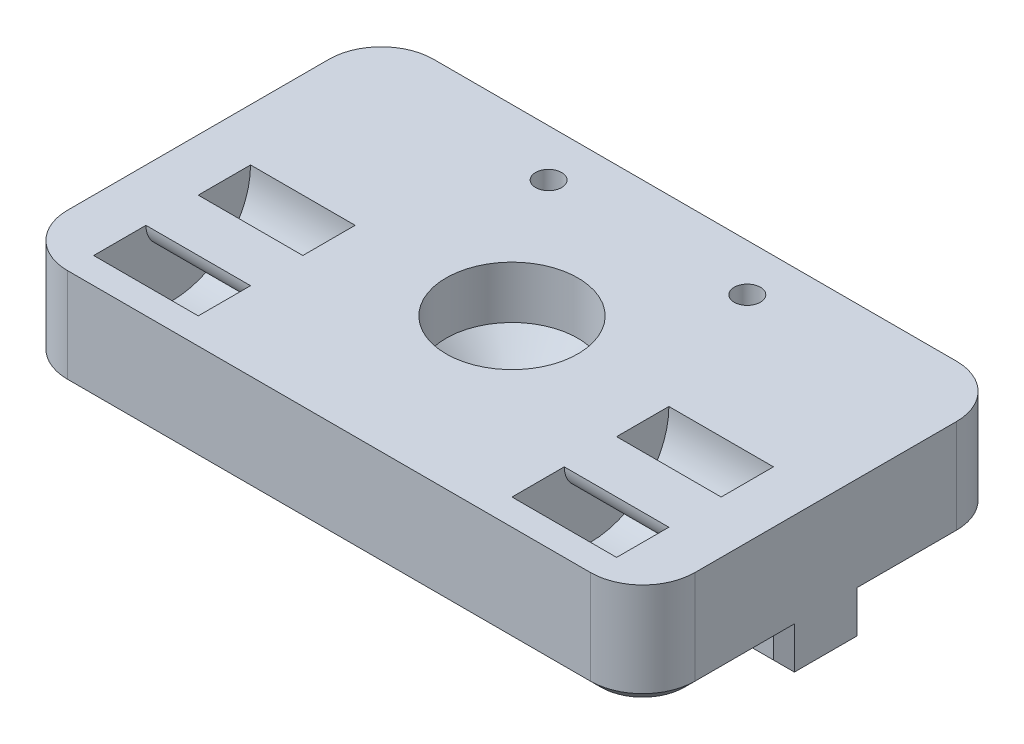
from build123d import *

# Parameters (mm, degrees)
BOSS_EXTRUDE1_DEPTH   = 30
CUT_EXTRUDE1_DEPTH    = 5
FILLET1_R             = 5
CHAMFER1_SIZE         = 1
M3X0_5_TAPPED_HOLE1_D = 2.5


with BuildPart() as part:
    # Sketch1 → Boss-Extrude1 (new, symmetric)
    with BuildSketch(Plane(origin=(0, 0, 0), x_dir=(0, 0, -1), z_dir=(1, 0, 0))):
        Polygon((-17.5, 10), (17.5, 10), (17.5, 0), (4, 0), (4, -3), (-4, -3), (-4, 0), (-17.5, 0), align=None)
    extrude(amount=BOSS_EXTRUDE1_DEPTH, both=True)

    # Sketch3 → CSK for M6 Flat Head Machine Screw1 (revolve, cut)
    with BuildSketch(Plane(origin=(0, 10, 0), x_dir=(0, 0, 1), z_dir=(1, 0, 0))):
        Polygon((0, 0), (0, 13), (3.3, 13), (3.3, 8), (6.3, 5), (6.3, 0), align=None)
    revolve(axis=Axis((0, 16.35, 0), (0, -1, 0)), mode=Mode.SUBTRACT)

    # Sketch4 → Cut-Extrude1 (cut, symmetric)
    with BuildSketch(Plane(origin=(20, 0, 0), x_dir=(0, 0, -1), z_dir=(1, 0, 0))):
        with BuildLine():
            Line((-15, 10), (-10, 10))
            ThreePointArc((-10, 10), (-7.5, 7.5), (-5, 10))
            Line((-5, 10), (0, 10))
            ThreePointArc((0, 10), (-7.5, 2.5), (-15, 10))
        make_face()
    cut_extrude1 = extrude(amount=CUT_EXTRUDE1_DEPTH, both=True, mode=Mode.SUBTRACT)

    # Mirror1: Cut-Extrude1 across plane
    add(cut_extrude1.mirror(Plane(origin=(0, 0, 0), x_dir=(0, 0, 1), z_dir=(1, 0, 0))), mode=Mode.SUBTRACT)

    # Fillet1
    fillet1_edges = [part.edges().sort_by_distance(p)[0] for p in [
        (-30, 5, 17.5),
        (30, 5, -17.5),
        (30, 5, 17.5),
        (-30, 5, -17.5),
    ]]
    fillet(fillet1_edges, radius=FILLET1_R)

    # Chamfer1
    # the kernel refuses this chamfer: 1 mm, written as the material it takes off along each edge
    with BuildSketch(Plane(origin=(-30, -5.571682988, 4), x_dir=(-0.027495876610585623, 0, -0.9996219169112968), z_dir=(0, 1, 0)), Plane(origin=(-30, 0, -4), x_dir=(-0.027495876610585623, 0, 0.9996219169112968), z_dir=(0, -1, 0))) as chamfer1_piece_1:
        Polygon((CHAMFER1_SIZE * 0.999621916911, -CHAMFER1_SIZE * 0.0274958766106), (-CHAMFER1_SIZE * 0.0274958766106, -CHAMFER1_SIZE * 0.999621916911), (0, 0), align=None)
    extrude(amount=5.571682988, mode=Mode.SUBTRACT)
    with BuildSketch(Plane(origin=(30, -5.571682988, 4), x_dir=(0.027495876610585623, 0, -0.9996219169112968), z_dir=(0, 1, 0)), Plane(origin=(30, 0, -4), x_dir=(0.027495876610585623, 0, 0.9996219169112968), z_dir=(0, -1, 0))) as chamfer1_piece_2:
        Polygon((CHAMFER1_SIZE * 0.999621916911, CHAMFER1_SIZE * 0.0274958766106), (-CHAMFER1_SIZE * 0.0274958766106, CHAMFER1_SIZE * 0.999621916911), (0, 0), align=None)
    extrude(amount=5.571682988, mode=Mode.SUBTRACT)
    with BuildSketch(Plane(origin=(32.571682988, -3, -4), x_dir=(0, 0.9996219169112968, -0.027495876610586494), z_dir=(-1, 0, 0))) as chamfer1_piece_3:
        Polygon((CHAMFER1_SIZE * 0.999621916911, -CHAMFER1_SIZE * 0.0274958766106), (-CHAMFER1_SIZE * 0.0274958766106, -CHAMFER1_SIZE * 0.999621916911), (0, 0), align=None)
    extrude(amount=65.143365976, mode=Mode.SUBTRACT)
    with BuildSketch(Plane(origin=(32.571682988, -3, 4), x_dir=(0, 0.9996219169112968, 0.027495876610586494), z_dir=(-1, 0, 0))) as chamfer1_piece_4:
        Polygon((CHAMFER1_SIZE * 0.999621916911, CHAMFER1_SIZE * 0.0274958766106), (-CHAMFER1_SIZE * 0.0274958766106, CHAMFER1_SIZE * 0.999621916911), (0, 0), align=None)
    extrude(amount=65.143365976, mode=Mode.SUBTRACT)
    with BuildSketch(Plane(origin=(30, 0, -12.5), x_dir=(0.027495876610585623, 0.9996219169112968, 0), z_dir=(0, 0, 1)), Plane(origin=(30, 0, 4), x_dir=(0.02749587661058563, 0.9996219169112968, 0), z_dir=(0, 0, 1))) as chamfer1_piece_5:
        Polygon((CHAMFER1_SIZE * 0.999621916911, CHAMFER1_SIZE * 0.0274958766106), (-CHAMFER1_SIZE * 0.0274958766106, CHAMFER1_SIZE * 0.999621916911), (0, 0), align=None)
    extrude(amount=8.5, mode=Mode.SUBTRACT)
    with BuildSketch(Plane(origin=(-30, 0, 4), x_dir=(-0.02749587661058563, 0.9996219169112968, 0), z_dir=(0, 0, 1)), Plane(origin=(-30, 0, -12.5), x_dir=(-0.027495876610585623, 0.9996219169112968, 0), z_dir=(0, 0, 1))) as chamfer1_piece_6:
        Polygon((CHAMFER1_SIZE * 0.999621916911, -CHAMFER1_SIZE * 0.0274958766106), (-CHAMFER1_SIZE * 0.0274958766106, -CHAMFER1_SIZE * 0.999621916911), (0, 0), align=None)
    extrude(amount=8.5, mode=Mode.SUBTRACT)
    with BuildSketch(Plane(origin=(-25, 0, 17.5), x_dir=(0, 0.9996219169112968, 0.02749587661058563), z_dir=(1, 0, 0)), Plane(origin=(25, 0, -17.5), x_dir=(0, 0.9996219169112968, -0.027495876610585623), z_dir=(-1, 0, 0))) as chamfer1_piece_7:
        Polygon((CHAMFER1_SIZE * 0.999621916911, -CHAMFER1_SIZE * 0.0274958766106), (-CHAMFER1_SIZE * 0.0274958766106, -CHAMFER1_SIZE * 0.999621916911), (0, 0), align=None)
    extrude(amount=50, mode=Mode.SUBTRACT)
    with BuildSketch(Plane(origin=(-25, 0, 12.5), x_dir=(0, 0, 1), z_dir=(1, 0, 0))) as chamfer1_piece_8:
        Polygon((5, -CHAMFER1_SIZE), (5 - CHAMFER1_SIZE, 0), (5, 0), align=None)
    revolve(axis=Axis((-25, 0, 12.5), (0, -1, 0)), revolution_arc=90, mode=Mode.SUBTRACT)
    with BuildSketch(Plane(origin=(25, 0, 12.5), x_dir=(0, 0, 1), z_dir=(-1, 0, 0))) as chamfer1_piece_9:
        Polygon((5, CHAMFER1_SIZE), (5 - CHAMFER1_SIZE, 0), (5, 0), align=None)
    revolve(axis=Axis((25, 0, 12.5), (0, 1, 0)), revolution_arc=90, mode=Mode.SUBTRACT)
    with BuildSketch(Plane(origin=(-25, 0, -12.5), x_dir=(-1, 0, 0), z_dir=(0, 0, 1))) as chamfer1_piece_10:
        Polygon((5, -CHAMFER1_SIZE), (5 - CHAMFER1_SIZE, 0), (5, 0), align=None)
    revolve(axis=Axis((-25, 0, -12.5), (0, -1, 0)), revolution_arc=90, mode=Mode.SUBTRACT)
    with BuildSketch(Plane(origin=(25, 0, -12.5), x_dir=(1, 0, 0), z_dir=(0, 0, 1))) as chamfer1_piece_11:
        Polygon((5, CHAMFER1_SIZE), (5 - CHAMFER1_SIZE, 0), (5, 0), align=None)
    revolve(axis=Axis((25, 0, -12.5), (0, 1, 0)), revolution_arc=90, mode=Mode.SUBTRACT)
    with BuildSketch(Plane(origin=(-30, 0, 1.428317012), x_dir=(-0.02749587661058563, 0.9996219169112968, 0), z_dir=(0, 0, 1))) as chamfer1_piece_12a_section:
        Polygon((CHAMFER1_SIZE * 0.999621916911, -CHAMFER1_SIZE * 0.0274958766106), (-CHAMFER1_SIZE * 0.0274958766106, -CHAMFER1_SIZE * 0.999621916911), (0, 0), align=None)
    chamfer1_piece_12a = extrude(amount=11.071682988, mode=Mode.PRIVATE)
    chamfer1_piece_12a = split(chamfer1_piece_12a, bisect_by=Plane(origin=(-29.670206373, 0.329793627, 4), z_dir=(0, 0, -1)), keep=Keep.TOP, mode=Mode.PRIVATE)
    with BuildSketch(Plane(origin=(-30, -5.571682988, 4), x_dir=(-0.027495876610585623, 0, -0.9996219169112968), z_dir=(0, 1, 0))) as chamfer1_piece_12b_section:
        Polygon((CHAMFER1_SIZE * 0.999621916911, -CHAMFER1_SIZE * 0.0274958766106), (-CHAMFER1_SIZE * 0.0274958766106, -CHAMFER1_SIZE * 0.999621916911), (0, 0), align=None)
    chamfer1_piece_12b = extrude(amount=8.143365976, mode=Mode.PRIVATE)
    chamfer1_piece_12b = split(chamfer1_piece_12b, bisect_by=Plane(origin=(-29.670206373, 0, 3.670206373), z_dir=(0, 1, 0)), keep=Keep.TOP, mode=Mode.PRIVATE)
    chamfer1_piece_12 = chamfer1_piece_12a & chamfer1_piece_12b
    add(chamfer1_piece_12, mode=Mode.SUBTRACT)
    with BuildSketch(Plane(origin=(30, 0, 1.428317012), x_dir=(0.02749587661058563, 0.9996219169112968, 0), z_dir=(0, 0, 1))) as chamfer1_piece_13a_section:
        Polygon((CHAMFER1_SIZE * 0.999621916911, CHAMFER1_SIZE * 0.0274958766106), (-CHAMFER1_SIZE * 0.0274958766106, CHAMFER1_SIZE * 0.999621916911), (0, 0), align=None)
    chamfer1_piece_13a = extrude(amount=11.071682988, mode=Mode.PRIVATE)
    chamfer1_piece_13a = split(chamfer1_piece_13a, bisect_by=Plane(origin=(29.670206373, 0.329793627, 4), z_dir=(0, 0, -1)), keep=Keep.TOP, mode=Mode.PRIVATE)
    with BuildSketch(Plane(origin=(30, -5.571682988, 4), x_dir=(0.027495876610585623, 0, -0.9996219169112968), z_dir=(0, 1, 0))) as chamfer1_piece_13b_section:
        Polygon((CHAMFER1_SIZE * 0.999621916911, CHAMFER1_SIZE * 0.0274958766106), (-CHAMFER1_SIZE * 0.0274958766106, CHAMFER1_SIZE * 0.999621916911), (0, 0), align=None)
    chamfer1_piece_13b = extrude(amount=8.143365976, mode=Mode.PRIVATE)
    chamfer1_piece_13b = split(chamfer1_piece_13b, bisect_by=Plane(origin=(29.670206373, 0, 3.670206373), z_dir=(0, 1, 0)), keep=Keep.TOP, mode=Mode.PRIVATE)
    chamfer1_piece_13 = chamfer1_piece_13a & chamfer1_piece_13b
    add(chamfer1_piece_13, mode=Mode.SUBTRACT)
    with BuildSketch(Plane(origin=(30, 0, -12.5), x_dir=(0.027495876610585623, 0.9996219169112968, 0), z_dir=(0, 0, 1))) as chamfer1_piece_14a_section:
        Polygon((CHAMFER1_SIZE * 0.999621916911, CHAMFER1_SIZE * 0.0274958766106), (-CHAMFER1_SIZE * 0.0274958766106, CHAMFER1_SIZE * 0.999621916911), (0, 0), align=None)
    chamfer1_piece_14a = extrude(amount=11.071682988, mode=Mode.PRIVATE)
    chamfer1_piece_14a = split(chamfer1_piece_14a, bisect_by=Plane(origin=(29.670206373, 0.329793627, -4), z_dir=(0, 0, 1)), keep=Keep.TOP, mode=Mode.PRIVATE)
    with BuildSketch(Plane(origin=(30, 2.571682988, -4), x_dir=(0.027495876610585623, 0, 0.9996219169112968), z_dir=(0, -1, 0))) as chamfer1_piece_14b_section:
        Polygon((CHAMFER1_SIZE * 0.999621916911, CHAMFER1_SIZE * 0.0274958766106), (-CHAMFER1_SIZE * 0.0274958766106, CHAMFER1_SIZE * 0.999621916911), (0, 0), align=None)
    chamfer1_piece_14b = extrude(amount=8.143365976, mode=Mode.PRIVATE)
    chamfer1_piece_14b = split(chamfer1_piece_14b, bisect_by=Plane(origin=(29.670206373, 0, -3.670206373), z_dir=(0, 1, 0)), keep=Keep.TOP, mode=Mode.PRIVATE)
    chamfer1_piece_14 = chamfer1_piece_14a & chamfer1_piece_14b
    add(chamfer1_piece_14, mode=Mode.SUBTRACT)
    with BuildSketch(Plane(origin=(-30, 0, -12.5), x_dir=(-0.027495876610585623, 0.9996219169112968, 0), z_dir=(0, 0, 1))) as chamfer1_piece_15a_section:
        Polygon((CHAMFER1_SIZE * 0.999621916911, -CHAMFER1_SIZE * 0.0274958766106), (-CHAMFER1_SIZE * 0.0274958766106, -CHAMFER1_SIZE * 0.999621916911), (0, 0), align=None)
    chamfer1_piece_15a = extrude(amount=11.071682988, mode=Mode.PRIVATE)
    chamfer1_piece_15a = split(chamfer1_piece_15a, bisect_by=Plane(origin=(-29.670206373, 0.329793627, -4), z_dir=(0, 0, 1)), keep=Keep.TOP, mode=Mode.PRIVATE)
    with BuildSketch(Plane(origin=(-30, 2.571682988, -4), x_dir=(-0.027495876610585623, 0, 0.9996219169112968), z_dir=(0, -1, 0))) as chamfer1_piece_15b_section:
        Polygon((CHAMFER1_SIZE * 0.999621916911, -CHAMFER1_SIZE * 0.0274958766106), (-CHAMFER1_SIZE * 0.0274958766106, -CHAMFER1_SIZE * 0.999621916911), (0, 0), align=None)
    chamfer1_piece_15b = extrude(amount=8.143365976, mode=Mode.PRIVATE)
    chamfer1_piece_15b = split(chamfer1_piece_15b, bisect_by=Plane(origin=(-29.670206373, 0, -3.670206373), z_dir=(0, 1, 0)), keep=Keep.TOP, mode=Mode.PRIVATE)
    chamfer1_piece_15 = chamfer1_piece_15a & chamfer1_piece_15b
    add(chamfer1_piece_15, mode=Mode.SUBTRACT)

    # M3x0.5 Tapped Hole1 (through all)
    with Locations(Plane(origin=(0, 10, 0), x_dir=(1, 0, 0), z_dir=(0, 1, 0))):
        with Locations((-9.5, 13), (9.5, 13)):
            Hole(M3X0_5_TAPPED_HOLE1_D / 2)


solid = part.part
